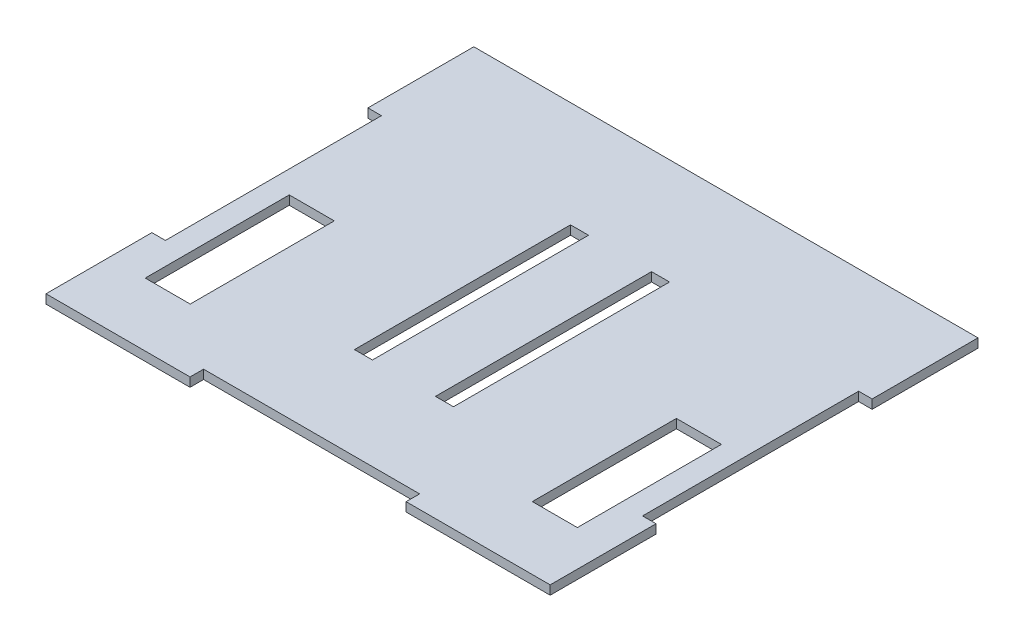
from build123d import *

# Parameters (mm, degrees)
BOSS_EXTRUDE1_DEPTH     = 6.35
SKETCH13_W              = 12.7
SKETCH13_H              = 152.4
CUT_EXTRUDE8_DEPTH      = 252.527339468
CUT_EXTRUDE9_DEPTH      = 2.54
CUT_EXTRUDE9_DEPTH_BACK = 252.527339468
SKETCH4_W               = 31.75
SKETCH4_H               = 101.6


with BuildPart() as part:
    # Sketch1 → Boss-Extrude1 (new body)
    with BuildSketch(Plane(origin=(0, 0, 0), x_dir=(1, 0, 0), z_dir=(0, 1, 0))):
        Polygon((-177.8, -177.8), (-76.2, -177.8), (-76.2, -168.275), (76.2, -168.275), (76.2, -177.8), (177.8, -177.8), (177.8, -103.124), (168.275, -103.124), (168.275, 49.276), (177.8, 49.276), (177.8, 123.952), (-177.8, 123.952), (-177.8, 49.276), (-168.275, 49.276), (-168.275, -103.124), (-177.8, -103.124), align=None)
    extrude(amount=BOSS_EXTRUDE1_DEPTH)

    # Sketch13 → Cut-Extrude8 (cut, through all)
    with BuildSketch(Plane(origin=(0, 6.35, 0), x_dir=(1, 0, 0), z_dir=(0, 1, 0))):
        with Locations((-28.575, -26.924)):
            Rectangle(SKETCH13_W, SKETCH13_H)
        with Locations((28.575, -26.924)):
            Rectangle(SKETCH13_W, SKETCH13_H)
    extrude(amount=-CUT_EXTRUDE8_DEPTH, mode=Mode.SUBTRACT)

    # Sketch4 → Cut-Extrude9 (cut, two sides: drawn at the far end of the back side and taken through both)
    with BuildSketch(Plane(origin=(0, 6.35, 0), x_dir=(1, 0, 0), z_dir=(0, 1, 0)).offset(-CUT_EXTRUDE9_DEPTH_BACK)):
        with Locations((136.525, -82.423)):
            Rectangle(SKETCH4_W, SKETCH4_H)
        with Locations((-136.525, -82.423)):
            Rectangle(SKETCH4_W, SKETCH4_H)
    extrude(amount=CUT_EXTRUDE9_DEPTH + CUT_EXTRUDE9_DEPTH_BACK, mode=Mode.SUBTRACT)


solid = part.part
